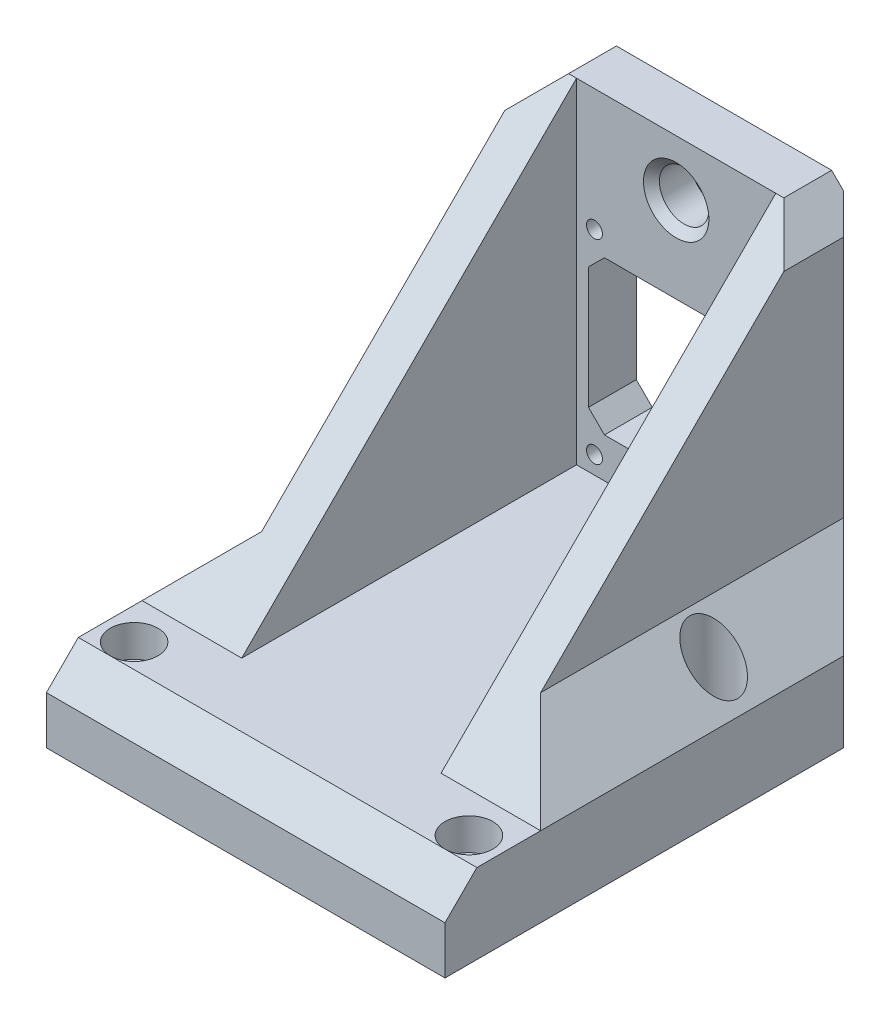
from build123d import *

# Parameters (mm, degrees)
SKETCH1_W           = 50
SKETCH1_H           = 60
BOSS_EXTRUDE1_DEPTH = 10
SKETCH2_R           = 1.5
CUT_EXTRUDE1_DEPTH  = 6
CUT_EXTRUDE2_REACH  = 41.509
SKETCH3_R           = 3
SKETCH5_W           = 25
SKETCH5_H           = 6
BOSS_EXTRUDE3_DEPTH = 42
CUT_EXTRUDE3_REACH  = 85.241
SKETCH6_W           = 22
SKETCH6_H           = 19.25
SKETCH7_R           = 1
CUT_EXTRUDE4_DEPTH  = 2.5
CUT_EXTRUDE5_REACH  = 82.754
SKETCH8_R           = 2
BOSS_EXTRUDE4_DEPTH = 5
CHAMFER1_SIZE       = 7.5
CHAMFER2_SIZE       = 10
CHAMFER4_SIZE       = 6.5
CHAMFER5_SIZE       = 4
CHAMFER6_SIZE       = 4
CHAMFER7_SIZE       = 2
CUT_EXTRUDE6_REACH  = 85.241
SKETCH10_R          = 3.1
CHAMFER8_SIZE       = 1


# Some blends are built 0.0001 mm under size
with BuildPart() as part:
    # Sketch1 → Boss-Extrude1 (new body)
    with BuildSketch(Plane(origin=(0, 0, 0), x_dir=(1, 0, 0), z_dir=(0, 1, 0))):
        Rectangle(SKETCH1_W, SKETCH1_H)
    extrude(amount=BOSS_EXTRUDE1_DEPTH)

    # Sketch2 → Cut-Extrude1 (cut)
    with BuildSketch(Plane(origin=(0, 0, 0), x_dir=(1, 0, 0), z_dir=(0, 1, 0))):
        with Locations(Location((-21, 7.7, 0), (0, 0, 270))):
            Circle(SKETCH2_R)
        with Locations(Location((-21, -23, 0), (0, 0, 270))):
            Circle(SKETCH2_R)
        with Locations(Location((21, 7.7, 0), (0, 0, 270))):
            Circle(SKETCH2_R)
        with Locations(Location((21, -23, 0), (0, 0, 270))):
            Circle(SKETCH2_R)
    extrude(amount=CUT_EXTRUDE1_DEPTH, mode=Mode.SUBTRACT)

    # Sketch3 → Cut-Extrude2 (cut, up to next)
    with BuildSketch(Plane.XZ.offset(-6), mode=Mode.PRIVATE) as cut_extrude2_sk1:
        with Locations(Location((-21, 23, 0), (0, 0, 270))):
            Circle(SKETCH3_R)
    cut_extrude2_tool1 = extrude(cut_extrude2_sk1.sketch, amount=-CUT_EXTRUDE2_REACH, mode=Mode.PRIVATE) & part.part
    # Sketch3 → Cut-Extrude2 (cut, up to next)
    with BuildSketch(Plane.XZ.offset(-6), mode=Mode.PRIVATE) as cut_extrude2_sk2:
        with Locations(Location((21, 23, 0), (0, 0, 270))):
            Circle(SKETCH3_R)
    cut_extrude2_tool2 = extrude(cut_extrude2_sk2.sketch, amount=-CUT_EXTRUDE2_REACH, mode=Mode.PRIVATE) & part.part
    # Sketch3 → Cut-Extrude2 (cut, up to next)
    with BuildSketch(Plane.XZ.offset(-6), mode=Mode.PRIVATE) as cut_extrude2_sk3:
        with Locations(Location((21, -7.7, 0), (0, 0, 270))):
            Circle(SKETCH3_R)
    cut_extrude2_tool3 = extrude(cut_extrude2_sk3.sketch, amount=-CUT_EXTRUDE2_REACH, mode=Mode.PRIVATE) & part.part
    # Sketch3 → Cut-Extrude2 (cut, up to next)
    with BuildSketch(Plane.XZ.offset(-6), mode=Mode.PRIVATE) as cut_extrude2_sk4:
        with Locations(Location((-21, -7.7, 0), (0, 0, 270))):
            Circle(SKETCH3_R)
    cut_extrude2_tool4 = extrude(cut_extrude2_sk4.sketch, amount=-CUT_EXTRUDE2_REACH, mode=Mode.PRIVATE) & part.part
    add(cut_extrude2_tool1.solids().sort_by_distance((-21, 6, 23))[0], mode=Mode.SUBTRACT)
    add(cut_extrude2_tool2.solids().sort_by_distance((21, 6, 23))[0], mode=Mode.SUBTRACT)
    add(cut_extrude2_tool3.solids().sort_by_distance((21, 6, -7.7))[0], mode=Mode.SUBTRACT)
    add(cut_extrude2_tool4.solids().sort_by_distance((-21, 6, -7.7))[0], mode=Mode.SUBTRACT)

    # Sketch5 → Boss-Extrude3 (add)
    with BuildSketch(Plane(origin=(0, 10, 0), x_dir=(1, 0, 0), z_dir=(0, 1, 0))):
        with Locations((0, 27)):
            Rectangle(SKETCH5_W, SKETCH5_H)
    extrude(amount=BOSS_EXTRUDE3_DEPTH)

    # Sketch6 → Cut-Extrude3 (cut, up to next)
    with BuildSketch(Plane(origin=(0, 0, -30), x_dir=(-1, 0, 0), z_dir=(0, 0, -1)), mode=Mode.PRIVATE) as cut_extrude3_sk1:
        with Locations((0, 24.625)):
            Rectangle(SKETCH6_W, SKETCH6_H)
    cut_extrude3_tool1 = extrude(cut_extrude3_sk1.sketch, amount=-CUT_EXTRUDE3_REACH, mode=Mode.PRIVATE) & part.part
    add(cut_extrude3_tool1.solids().sort_by_distance((0, 24.625, -30))[0], mode=Mode.SUBTRACT)

    # Sketch7 → Cut-Extrude4 (cut)
    with BuildSketch(Plane.XY.offset(-24)):
        with Locations((10.25, 12.25)):
            Circle(SKETCH7_R)
        with Locations((-10.25, 12.25)):
            Circle(SKETCH7_R)
        with Locations((-10.25, 36.7)):
            Circle(SKETCH7_R)
        with Locations((10.25, 36.7)):
            Circle(SKETCH7_R)
    extrude(amount=-CUT_EXTRUDE4_DEPTH, mode=Mode.SUBTRACT)

    # Sketch8 → Cut-Extrude5 (cut, up to next)
    with BuildSketch(Plane.XY.offset(-26.5), mode=Mode.PRIVATE) as cut_extrude5_sk1:
        with Locations((-10.25, 36.7)):
            Circle(SKETCH8_R)
    cut_extrude5_tool1 = extrude(cut_extrude5_sk1.sketch, amount=-CUT_EXTRUDE5_REACH, mode=Mode.PRIVATE) & part.part
    # Sketch8 → Cut-Extrude5 (cut, up to next)
    with BuildSketch(Plane.XY.offset(-26.5), mode=Mode.PRIVATE) as cut_extrude5_sk2:
        with Locations((10.25, 36.7)):
            Circle(SKETCH8_R)
    cut_extrude5_tool2 = extrude(cut_extrude5_sk2.sketch, amount=-CUT_EXTRUDE5_REACH, mode=Mode.PRIVATE) & part.part
    # Sketch8 → Cut-Extrude5 (cut, up to next)
    with BuildSketch(Plane.XY.offset(-26.5), mode=Mode.PRIVATE) as cut_extrude5_sk3:
        with Locations((10.25, 12.25)):
            Circle(SKETCH8_R)
    cut_extrude5_tool3 = extrude(cut_extrude5_sk3.sketch, amount=-CUT_EXTRUDE5_REACH, mode=Mode.PRIVATE) & part.part
    # Sketch8 → Cut-Extrude5 (cut, up to next)
    with BuildSketch(Plane.XY.offset(-26.5), mode=Mode.PRIVATE) as cut_extrude5_sk4:
        with Locations((-10.25, 12.25)):
            Circle(SKETCH8_R)
    cut_extrude5_tool4 = extrude(cut_extrude5_sk4.sketch, amount=-CUT_EXTRUDE5_REACH, mode=Mode.PRIVATE) & part.part
    add(cut_extrude5_tool1.solids().sort_by_distance((-10.25, 36.7, -26.5))[0], mode=Mode.SUBTRACT)
    add(cut_extrude5_tool2.solids().sort_by_distance((10.25, 36.7, -26.5))[0], mode=Mode.SUBTRACT)
    add(cut_extrude5_tool3.solids().sort_by_distance((10.25, 12.25, -26.5))[0], mode=Mode.SUBTRACT)
    add(cut_extrude5_tool4.solids().sort_by_distance((-10.25, 12.25, -26.5))[0], mode=Mode.SUBTRACT)

    # Sketch9 → Boss-Extrude4 (add)
    with BuildSketch(Plane(origin=(12.5, 0, 0), x_dir=(0, 0, -1), z_dir=(1, 0, 0))):
        Polygon((30, 52), (24, 52), (-18, 10), (30, 10), align=None)
    boss_extrude4 = extrude(amount=BOSS_EXTRUDE4_DEPTH)

    # Mirror1: Boss-Extrude4 across plane
    add(boss_extrude4.mirror(Plane(origin=(0, 0, 0), x_dir=(0, 0, 1), z_dir=(1, 0, 0))))

    # Chamfer1
    # the kernel refuses this chamfer: 7.5 mm, written as the material it adds along each edge
    with BuildSketch(Plane(origin=(17.5, 10, 37.28762241), x_dir=(-0.02749587661058632, 0.9996219169112968, 0), z_dir=(0, 0, -1))) as chamfer1_piece_1_section:
        Polygon((CHAMFER1_SIZE * 0.999621916911, CHAMFER1_SIZE * 0.0274958766106), (-CHAMFER1_SIZE * 0.0274958766106, CHAMFER1_SIZE * 0.999621916911), (0, 0), align=None)
    chamfer1_piece_1 = extrude(amount=67.28762241, mode=Mode.PRIVATE)
    chamfer1_piece_1 = split(chamfer1_piece_1, bisect_by=Plane(origin=(18.496268946, 33.174911168, -5.174911168), z_dir=(0, -0.7071067811865462, -0.7071067811865489)), keep=Keep.TOP, mode=Mode.PRIVATE)
    chamfer1_piece_1 = chamfer1_piece_1 - Plane(origin=(21, 16.349822336, -7.7), x_dir=(0, 0, -1), z_dir=(0, -1, 0)) * Cylinder(3, 165, mode=Mode.PRIVATE)
    chamfer1_piece_1 = split(chamfer1_piece_1, bisect_by=Plane(origin=(25, 16.349822336, -22), z_dir=(-1, 0, 0)), keep=Keep.TOP, mode=Mode.PRIVATE)
    add(chamfer1_piece_1)
    with BuildSketch(Plane(origin=(-17.5, 10, 37.28762241), x_dir=(0.02749587661058632, 0.9996219169112968, 0), z_dir=(0, 0, -1))) as chamfer1_piece_2_section:
        Polygon((CHAMFER1_SIZE * 0.999621916911, -CHAMFER1_SIZE * 0.0274958766106), (-CHAMFER1_SIZE * 0.0274958766106, -CHAMFER1_SIZE * 0.999621916911), (0, 0), align=None)
    chamfer1_piece_2 = extrude(amount=67.28762241, mode=Mode.PRIVATE)
    chamfer1_piece_2 = split(chamfer1_piece_2, bisect_by=Plane(origin=(-18.49626887, 33.174911131, -5.174911131), z_dir=(0, -0.7071067811865462, -0.7071067811865489)), keep=Keep.TOP, mode=Mode.PRIVATE)
    chamfer1_piece_2 = chamfer1_piece_2 - Plane(origin=(-21, 16.349822261, -7.7), x_dir=(0, 0, -1), z_dir=(0, -1, 0)) * Cylinder(3, 165, mode=Mode.PRIVATE)
    chamfer1_piece_2 = split(chamfer1_piece_2, bisect_by=Plane(origin=(-25, 16.349822261, -22), z_dir=(1, 0, 0)), keep=Keep.TOP, mode=Mode.PRIVATE)
    add(chamfer1_piece_2)

    # Chamfer2
    chamfer2_edges = [part.edges().sort_by_distance(p)[0] for p in [
        (-25, 5, -30),
        (25, 5, -30),
    ]]
    chamfer(chamfer2_edges, length=CHAMFER2_SIZE)

    # Chamfer4
    chamfer4_edges = [part.edges().sort_by_distance(p)[0] for p in [
        (0, 0, -30),
    ]]
    chamfer(chamfer4_edges, length=CHAMFER4_SIZE)

    # Chamfer5
    chamfer5_edges = [part.edges().sort_by_distance(p)[0] for p in [
        (17.5, 52, -25.75),
        (-17.5, 52, -25.75),
    ]]
    chamfer(chamfer5_edges, length=CHAMFER5_SIZE)

    # Chamfer6
    chamfer6_edges = [part.edges().sort_by_distance(p)[0] for p in [
        (0, 10, 30),
    ]]
    chamfer(chamfer6_edges, length=CHAMFER6_SIZE - 0.0001)  # a hair under: the kernel refuses the full size

    # Chamfer7
    chamfer7_edges = [part.edges().sort_by_distance(p)[0] for p in [
        (-11, 34.25, -27),
        (-11, 15, -27),
        (11, 15, -27),
        (11, 34.25, -27),
    ]]
    chamfer(chamfer7_edges, length=CHAMFER7_SIZE)

    # Sketch10 → Cut-Extrude6 (cut, up to next)
    with BuildSketch(Plane(origin=(0, 0, -30), x_dir=(-1, 0, 0), z_dir=(0, 0, -1)), mode=Mode.PRIVATE) as cut_extrude6_sk1:
        with Locations((0, 45)):
            Circle(SKETCH10_R)
    cut_extrude6_tool1 = extrude(cut_extrude6_sk1.sketch, amount=-CUT_EXTRUDE6_REACH, mode=Mode.PRIVATE) & part.part
    add(cut_extrude6_tool1.solids().sort_by_distance((0, 45, -30))[0], mode=Mode.SUBTRACT)

    # Chamfer8
    chamfer8_edges = [part.edges().sort_by_distance(p)[0] for p in [
        (3.1, 45, -30),
        (3.1, 45, -24),
    ]]
    chamfer(chamfer8_edges, length=CHAMFER8_SIZE)


solid = part.part
